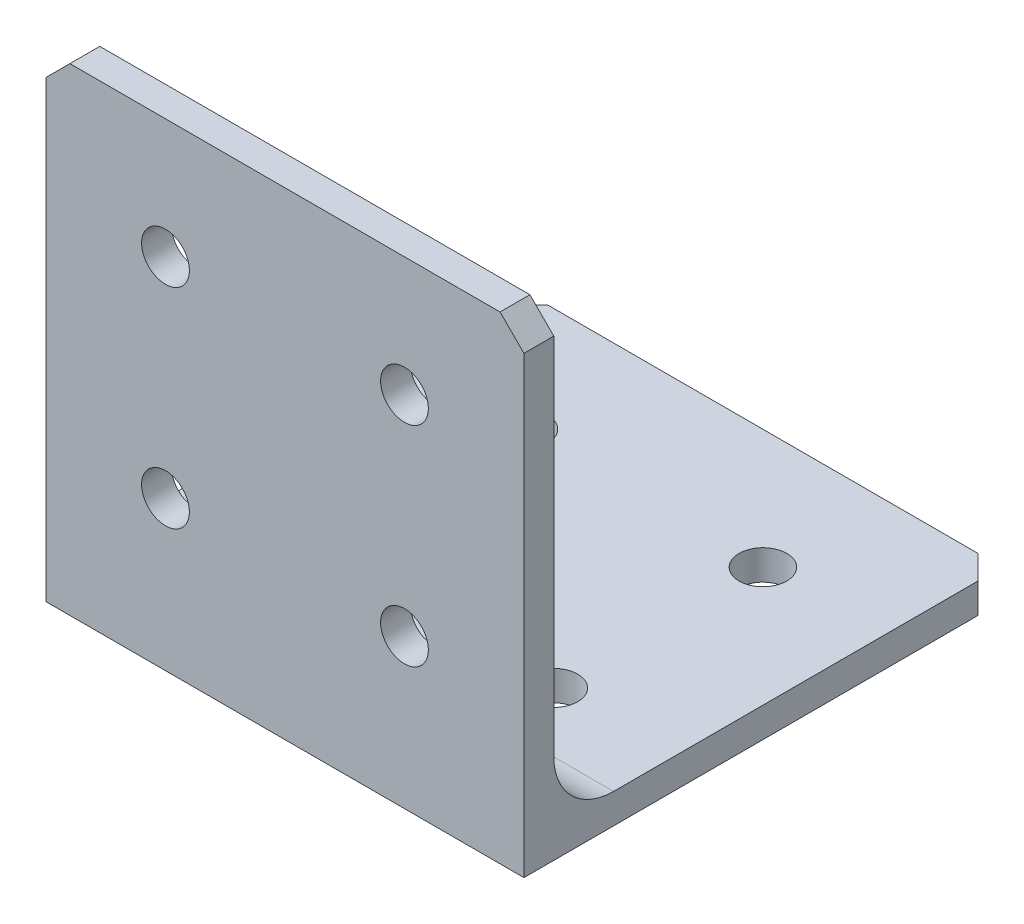
from build123d import *

# Parameters (mm, degrees)
BOSS_EXTRUDE1_DEPTH = 50.8
SKETCH2_R           = 2.54
CUT_EXTRUDE1_DEPTH  = 88.988181024
SKETCH3_R           = 2.54
CUT_EXTRUDE2_DEPTH  = 88.988181024
FILLET1_R           = 6.35
CHAMFER1_SIZE       = 2.54


with BuildPart() as part:
    # Sketch1 → Boss-Extrude1 (new body)
    with BuildSketch(Plane(origin=(0, 0, 0), x_dir=(0, 0, -1), z_dir=(1, 0, 0))):
        Polygon((0, 0), (0, 50.8), (3.175, 50.8), (3.175, 3.175), (50.8, 3.175), (50.8, 0), align=None)
    extrude(amount=BOSS_EXTRUDE1_DEPTH)

    # Sketch2 → Cut-Extrude1 (cut, through all)
    with BuildSketch(Plane.XY):
        with Locations((12.7, 38.1)):
            Circle(SKETCH2_R)
        with Locations((12.7, 15.875)):
            Circle(SKETCH2_R)
        with Locations((38.1, 38.1)):
            Circle(SKETCH2_R)
        with Locations((38.1, 15.875)):
            Circle(SKETCH2_R)
    extrude(amount=-CUT_EXTRUDE1_DEPTH, mode=Mode.SUBTRACT)

    # Sketch3 → Cut-Extrude2 (cut, through all)
    with BuildSketch(Plane.XZ):
        with Locations((38.1, -38.1)):
            Circle(SKETCH3_R)
        with Locations((38.1, -15.875)):
            Circle(SKETCH3_R)
        with Locations((12.7, -38.1)):
            Circle(SKETCH3_R)
        with Locations((12.7, -15.875)):
            Circle(SKETCH3_R)
    extrude(amount=-CUT_EXTRUDE2_DEPTH, mode=Mode.SUBTRACT)

    # Fillet1
    fillet1_edges = [part.edges().sort_by_distance(p)[0] for p in [
        (25.4, 3.175, -3.175),
    ]]
    fillet(fillet1_edges, radius=FILLET1_R)

    # Chamfer1
    chamfer1_edges = [part.edges().sort_by_distance(p)[0] for p in [
        (50.8, 50.8, -1.5875),
        (0, 50.8, -1.5875),
        (50.8, 1.5875, -50.8),
        (0, 1.5875, -50.8),
    ]]
    chamfer(chamfer1_edges, length=CHAMFER1_SIZE)


solid = part.part
